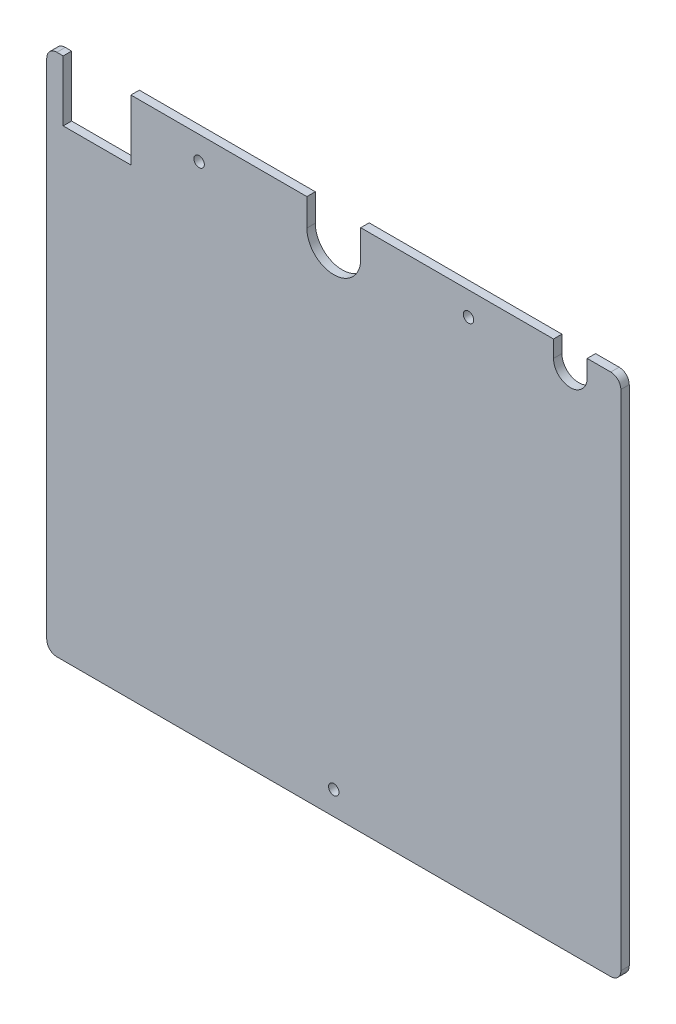
from build123d import *

# Parameters (mm, degrees)
RESSALTO_EXTRUS_O1_DEPTH = 2.5
ESBO_O2_R                = 1.55
ESBO_O2_W                = 20.114167529
ESBO_O2_H                = 18
CORTE_EXTRUS_O1_DEPTH    = 116.407430437


with BuildPart() as part:
    # Esboço1 → Ressalto-extrusão1 (new body)
    with BuildSketch(Plane.XY):
        with BuildLine():
            Line((-82.25, 77.75), (82.25, 77.75))
            ThreePointArc((82.25, 77.75), (84.371320344, 76.871320344), (85.25, 74.75))
            Line((85.25, 74.75), (85.25, -74.75))
            ThreePointArc((85.25, -74.75), (84.371320344, -76.871320344), (82.25, -77.75))
            Line((82.25, -77.75), (-82.25, -77.75))
            ThreePointArc((-82.25, -77.75), (-84.371320344, -76.871320344), (-85.25, -74.75))
            Line((-85.25, -74.75), (-85.25, 74.75))
            ThreePointArc((-85.25, 74.75), (-84.371320344, 76.871320344), (-82.25, 77.75))
        make_face()
    extrude(amount=RESSALTO_EXTRUS_O1_DEPTH)

    # Esboço2 → Corte-extrusão1 (cut, through all)
    with BuildSketch(Plane.XY.offset(2.5)):
        with Locations((0, -70.75)):
            Circle(ESBO_O2_R)
        with Locations((-40, 70.75)):
            Circle(ESBO_O2_R)
        with Locations((40, 70.75)):
            Circle(ESBO_O2_R)
        with BuildLine():
            Line((8, 69.65), (8, 77.75))
            Line((8, 77.75), (-8, 77.75))
            Line((-8, 77.75), (-8, 69.65))
            ThreePointArc((-8, 69.65), (0, 61.65), (8, 69.65))
        make_face()
        with Locations((-70.307083765, 68.75)):
            Rectangle(ESBO_O2_W, ESBO_O2_H)
        with BuildLine():
            Line((65.25, 77.75), (75.25, 77.75))
            Line((75.25, 77.75), (75.25, 72.75))
            ThreePointArc((75.25, 72.75), (70.25, 67.75), (65.25, 72.75))
            Line((65.25, 72.75), (65.25, 77.75))
        make_face()
    extrude(amount=-CORTE_EXTRUS_O1_DEPTH, mode=Mode.SUBTRACT)


solid = part.part
